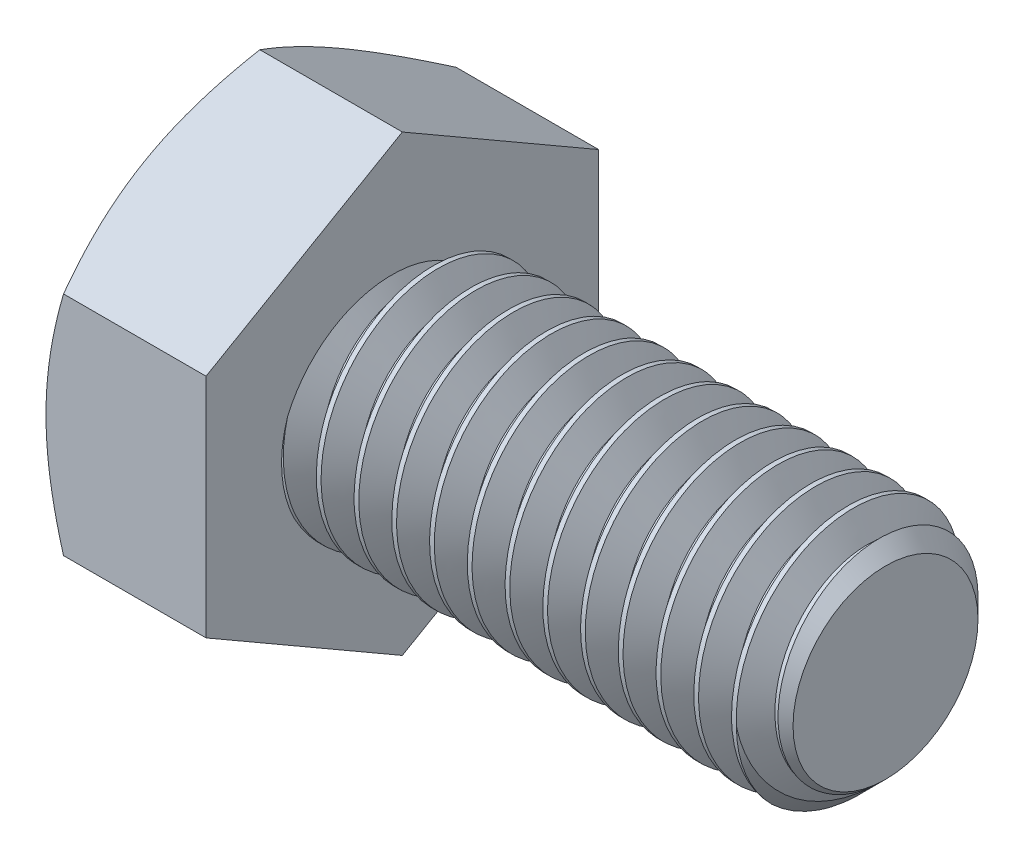
from build123d import *

# Parameters (mm, degrees)
SKETCH2_R           = 4
BOSS_EXTRUDE1_DEPTH = 16
CHAMFER1_SIZE       = 0.9375
CUT_SWEEP1_PITCH    = 1.25
BOSS_EXTRUDE2_DEPTH = 5.3
SKETCH6_OUTSIDE_W   = 105.696
SKETCH6_OUTSIDE_H   = 107.708
SKETCH6_OUTSIDE_R   = 6.5
CUT_EXTRUDE1_DEPTH  = 24.500496599
CUT_EXTRUDE1_DRAFT  = -60


with BuildPart() as part:
    # Sketch2 → Boss-Extrude1 (new body)
    with BuildSketch(Plane(origin=(10.65, 0, 0), x_dir=(0, 0, -1), z_dir=(1, 0, 0))):
        Circle(SKETCH2_R)
    extrude(amount=-BOSS_EXTRUDE1_DEPTH)

    # Chamfer1
    chamfer1_edges = [part.edges().sort_by_distance(p)[0] for p in [
        (10.65, 0, 4),
    ]]
    chamfer(chamfer1_edges, length=CHAMFER1_SIZE)

    # Cut-Sweep1: the profile of Sketch5 profile screwed along a right-hand helix of 13.8 turns, 8 arcs to a turn; built about Z, then put on its axis
    cut_sweep1_z = Axis((0, 0, 0), (0, 0, 1))
    cut_sweep1_corners = [(4.0003, 0, 0.000173205), (3.188101184, 0, -0.46875), (3.188101184, 0, -0.625), (4.0003, 0, -1.093923205)]
    with BuildLine(mode=Mode.PRIVATE) as cut_sweep1_profile:
        Line(cut_sweep1_corners[0], cut_sweep1_corners[1])
        Line(cut_sweep1_corners[1], cut_sweep1_corners[2])
        Line(cut_sweep1_corners[2], cut_sweep1_corners[3])
        Line(cut_sweep1_corners[3], cut_sweep1_corners[0])
    cut_sweep1_cap = Face(cut_sweep1_profile.wire())
    cut_sweep1_turn_angles = [0, 22.5, 45, 67.5, 90, 112.5, 135, 157.5, 180, 202.5, 225, 247.5, 270, 292.5, 315, 337.5, 360]
    cut_sweep1_turn_weights = [1, 0.9238795325112867, 1, 0.9238795325112867, 1, 0.9238795325112867, 1, 0.9238795325112867, 1, 0.9238795325112867, 1, 0.9238795325112867, 1, 0.9238795325112867, 1, 0.9238795325112867, 1]
    cut_sweep1_turn_rails = [Edge.make_bspline([Vector(p[0], p[1], 0).rotate(cut_sweep1_z, cut_sweep1_turn_angles[k]) / cut_sweep1_turn_weights[k] + Vector(0, 0, p[2] + CUT_SWEEP1_PITCH * cut_sweep1_turn_angles[k] / 360) for k in range(17)], [0, 0, 0, 1, 1, 2, 2, 3, 3, 4, 4, 5, 5, 6, 6, 7, 7, 8, 8, 8], 2, cut_sweep1_turn_weights) for p in cut_sweep1_corners]
    cut_sweep1_turn_sides = [Face.make_surface_from_curves(cut_sweep1_turn_rails[p[0]], cut_sweep1_turn_rails[p[1]]) for p in [(0, 1), (1, 2), (2, 3), (3, 0)]]
    cut_sweep1_last_angles = [4680, 4702.5, 4725, 4747.5, 4770, 4792.5, 4815, 4837.5, 4860, 4882.5, 4905, 4927.5, 4950, 4959, 4968]
    cut_sweep1_last_weights = [1, 0.9238795325112867, 1, 0.9238795325112867, 1, 0.9238795325112867, 1, 0.9238795325112867, 1, 0.9238795325112867, 1, 0.9238795325112867, 1, 0.9876883405951452, 1]
    cut_sweep1_last_rails = [Edge.make_bspline([Vector(p[0], p[1], 0).rotate(cut_sweep1_z, cut_sweep1_last_angles[k]) / cut_sweep1_last_weights[k] + Vector(0, 0, p[2] + CUT_SWEEP1_PITCH * cut_sweep1_last_angles[k] / 360) for k in range(15)], [0, 0, 0, 1, 1, 2, 2, 3, 3, 4, 4, 5, 5, 6, 6, 7, 7, 7], 2, cut_sweep1_last_weights) for p in cut_sweep1_corners]
    cut_sweep1_last_sides = [Face.make_surface_from_curves(cut_sweep1_last_rails[p[0]], cut_sweep1_last_rails[p[1]]) for p in [(0, 1), (1, 2), (2, 3), (3, 0)]]
    cut_sweep1 = Plane(origin=(10.65, 0, 0), x_dir=(0, 1, 0), z_dir=(-1, 0, 0)) * Solid(Shell([*[p.moved(Location((0, 0, CUT_SWEEP1_PITCH * i))) for i in range(13) for p in cut_sweep1_turn_sides], *cut_sweep1_last_sides, cut_sweep1_cap, cut_sweep1_cap.rotate(cut_sweep1_z, 4968).moved(Location((0, 0, CUT_SWEEP1_PITCH * 4968 / 360)))]))
    add(cut_sweep1, mode=Mode.SUBTRACT)

    # Sketch3 → Boss-Extrude2 (add)
    with BuildSketch(Plane.ZY.offset(5.35)):
        Polygon((-6.5, -3.75277675), (0, -7.505553499), (6.5, -3.75277675), (6.5, 3.75277675), (0, 7.505553499), (-6.5, 3.75277675), align=None)
    extrude(amount=BOSS_EXTRUDE2_DEPTH)


with BuildPart() as cut_extrude1_tool:
    # Sketch6 outside → Cut-Extrude1 (with draft: the straight prism first)
    with BuildSketch(Plane.ZY.offset(10.65)):
        Rectangle(SKETCH6_OUTSIDE_W, SKETCH6_OUTSIDE_H)
        Circle(SKETCH6_OUTSIDE_R, mode=Mode.SUBTRACT)
    extrude(amount=-CUT_EXTRUDE1_DEPTH)
    # Cut-Extrude1: the draft: its side faces are tilted about the plane it starts from
    cut_extrude1_sides = [cut_extrude1_tool.faces().sort_by_distance(p)[0] for p in [
        (1.600248299, -53.854, 0),
        (1.600248299, 0, 52.848),
        (1.600248299, 53.854, 0),
        (1.600248299, 0, -52.848),
        (1.600248299, 0, -6.5),
    ]]
    draft(cut_extrude1_sides, Plane.ZY.offset(10.65), CUT_EXTRUDE1_DRAFT)


with BuildPart() as part_1:
    add(part.part)

    # Cut-Extrude1: cut by cut_extrude1_tool
    add(cut_extrude1_tool.part, mode=Mode.SUBTRACT)


solid = part_1.part
